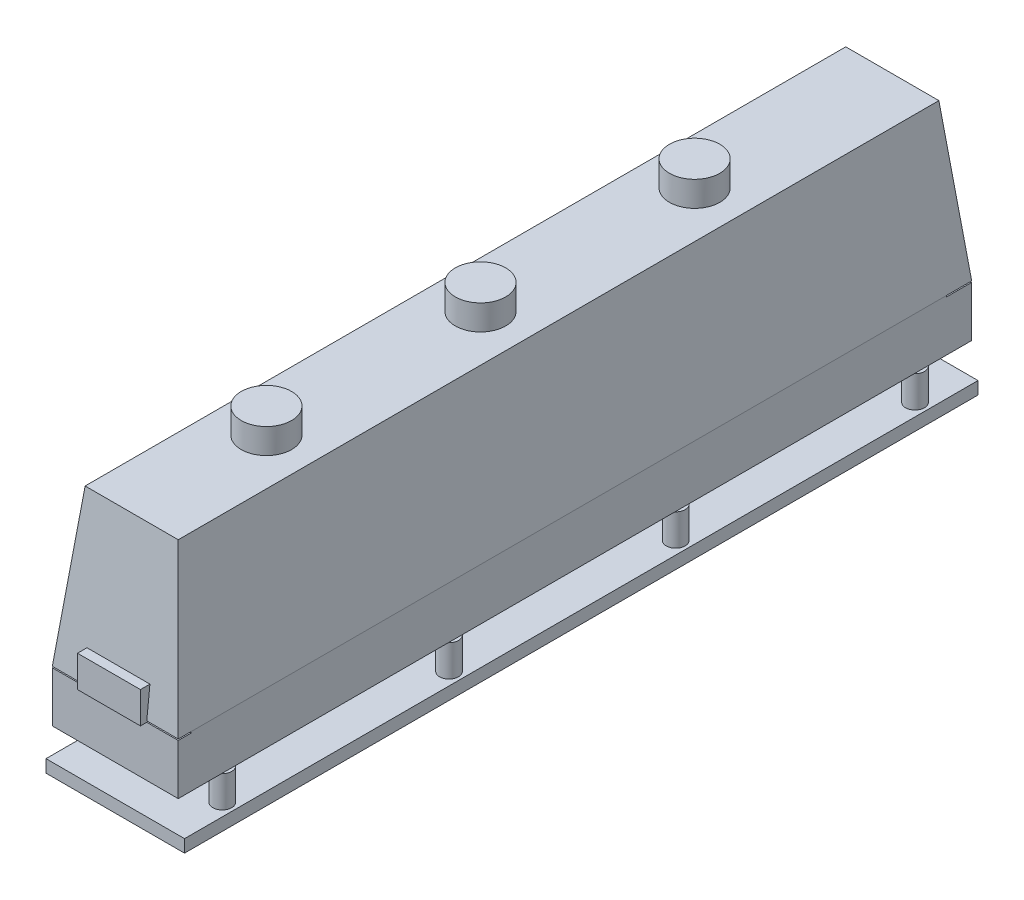
from build123d import *

# Parameters (mm, degrees)
SKETCH1_W            = 1100
SKETCH1_H            = 6300
BOSS_EXTRUDE1_DEPTH  = 100
BOSS_EXTRUDE2_START  = 100
SKETCH2_R            = 75
BOSS_EXTRUDE2_DEPTH  = 250
BOSS_EXTRUDE3_START  = 100
SKETCH3_R            = 75
BOSS_EXTRUDE3_DEPTH  = 250
BOSS_EXTRUDE4_START  = 100
SKETCH4_R            = 75
BOSS_EXTRUDE4_DEPTH  = 250
BOSS_EXTRUDE5_START  = 100
SKETCH5_R            = 75
BOSS_EXTRUDE5_DEPTH  = 250
BOSS_EXTRUDE6_START  = 100
SKETCH6_R            = 75
BOSS_EXTRUDE6_DEPTH  = 250
BOSS_EXTRUDE7_START  = 100
SKETCH7_R            = 75
BOSS_EXTRUDE7_DEPTH  = 250
BOSS_EXTRUDE8_START  = 100
SKETCH8_R            = 75
BOSS_EXTRUDE8_DEPTH  = 250
BOSS_EXTRUDE9_START  = 100
SKETCH9_R            = 75
BOSS_EXTRUDE9_DEPTH  = 250
BOSS_EXTRUDE10_START = 350
SKETCH10_W           = 1000
SKETCH10_H           = 6300
BOSS_EXTRUDE10_DEPTH = 400
BOSS_EXTRUDE11_START = 750
SKETCH11_W           = 500
SKETCH11_H           = 300
BOSS_EXTRUDE11_DEPTH = 250
BOSS_EXTRUDE12_START = 750
SKETCH12_W           = 1000
SKETCH12_H           = 6000
BOSS_EXTRUDE12_DEPTH = 10
BOSS_EXTRUDE13_START = 760
SKETCH13_W           = 1000
SKETCH13_H           = 6300
BOSS_EXTRUDE13_DEPTH = 1240
BOSS_EXTRUDE13_TAPER = 6
BOSS_EXTRUDE14_START = 2000
SKETCH14_R           = 200
BOSS_EXTRUDE14_DEPTH = 200
BOSS_EXTRUDE15_START = 2000
SKETCH15_R           = 200
BOSS_EXTRUDE15_DEPTH = 200
BOSS_EXTRUDE16_START = 2000
SKETCH16_R           = 200
BOSS_EXTRUDE16_DEPTH = 200
BOSS_EXTRUDE17_START = 600
SKETCH17_W           = 500
SKETCH17_H           = 250
BOSS_EXTRUDE17_DEPTH = 150


with BuildPart() as part:
    # Sketch1 → Boss-Extrude1 (new body)
    with BuildSketch(Plane(origin=(0, 0, 0), x_dir=(1, 0, 0), z_dir=(0, 1, 0))):
        with Locations((0, 5750)):
            Rectangle(SKETCH1_W, SKETCH1_H)
    extrude(amount=BOSS_EXTRUDE1_DEPTH)

    # Sketch2 → Boss-Extrude2 (add)
    with BuildSketch(Plane(origin=(0, 0, 0), x_dir=(1, 0, 0), z_dir=(0, 1, 0)).offset(BOSS_EXTRUDE2_START)):
        with Locations((-450, 3000)):
            Circle(SKETCH2_R)
    extrude(amount=BOSS_EXTRUDE2_DEPTH)

    # Sketch3 → Boss-Extrude3 (add)
    with BuildSketch(Plane(origin=(0, 0, 0), x_dir=(1, 0, 0), z_dir=(0, 1, 0)).offset(BOSS_EXTRUDE3_START)):
        with Locations((-450, 4800)):
            Circle(SKETCH3_R)
    extrude(amount=BOSS_EXTRUDE3_DEPTH)

    # Sketch4 → Boss-Extrude4 (add)
    with BuildSketch(Plane(origin=(0, 0, 0), x_dir=(1, 0, 0), z_dir=(0, 1, 0)).offset(BOSS_EXTRUDE4_START)):
        with Locations((-450, 6600)):
            Circle(SKETCH4_R)
    extrude(amount=BOSS_EXTRUDE4_DEPTH)

    # Sketch5 → Boss-Extrude5 (add)
    with BuildSketch(Plane(origin=(0, 0, 0), x_dir=(1, 0, 0), z_dir=(0, 1, 0)).offset(BOSS_EXTRUDE5_START)):
        with Locations((-450, 8500)):
            Circle(SKETCH5_R)
    extrude(amount=BOSS_EXTRUDE5_DEPTH)

    # Sketch6 → Boss-Extrude6 (add)
    with BuildSketch(Plane(origin=(0, 0, 0), x_dir=(1, 0, 0), z_dir=(0, 1, 0)).offset(BOSS_EXTRUDE6_START)):
        with Locations((450, 3000)):
            Circle(SKETCH6_R)
    extrude(amount=BOSS_EXTRUDE6_DEPTH)

    # Sketch7 → Boss-Extrude7 (add)
    with BuildSketch(Plane(origin=(0, 0, 0), x_dir=(1, 0, 0), z_dir=(0, 1, 0)).offset(BOSS_EXTRUDE7_START)):
        with Locations((450, 4800)):
            Circle(SKETCH7_R)
    extrude(amount=BOSS_EXTRUDE7_DEPTH)

    # Sketch8 → Boss-Extrude8 (add)
    with BuildSketch(Plane(origin=(0, 0, 0), x_dir=(1, 0, 0), z_dir=(0, 1, 0)).offset(BOSS_EXTRUDE8_START)):
        with Locations((450, 6600)):
            Circle(SKETCH8_R)
    extrude(amount=BOSS_EXTRUDE8_DEPTH)

    # Sketch9 → Boss-Extrude9 (add)
    with BuildSketch(Plane(origin=(0, 0, 0), x_dir=(1, 0, 0), z_dir=(0, 1, 0)).offset(BOSS_EXTRUDE9_START)):
        with Locations((450, 8500)):
            Circle(SKETCH9_R)
    extrude(amount=BOSS_EXTRUDE9_DEPTH)

    # Sketch10 → Boss-Extrude10 (add)
    with BuildSketch(Plane(origin=(0, 0, 0), x_dir=(1, 0, 0), z_dir=(0, 1, 0)).offset(BOSS_EXTRUDE10_START)):
        with Locations((0, 5750)):
            Rectangle(SKETCH10_W, SKETCH10_H)
    extrude(amount=BOSS_EXTRUDE10_DEPTH)

    # Sketch11 → Boss-Extrude11 (add)
    with BuildSketch(Plane(origin=(0, 0, 0), x_dir=(1, 0, 0), z_dir=(0, 1, 0)).offset(BOSS_EXTRUDE11_START)):
        with Locations((0, 2700)):
            Rectangle(SKETCH11_W, SKETCH11_H)
    extrude(amount=BOSS_EXTRUDE11_DEPTH)

    # Sketch12 → Boss-Extrude12 (add)
    with BuildSketch(Plane(origin=(0, 0, 0), x_dir=(1, 0, 0), z_dir=(0, 1, 0)).offset(BOSS_EXTRUDE12_START)):
        with Locations((0, 5700)):
            Rectangle(SKETCH12_W, SKETCH12_H)
    extrude(amount=BOSS_EXTRUDE12_DEPTH)

    # Sketch13 → Boss-Extrude13 (add)
    with BuildSketch(Plane(origin=(0, 0, 0), x_dir=(1, 0, 0), z_dir=(0, 1, 0)).offset(BOSS_EXTRUDE13_START)):
        with Locations((0, 5750)):
            Rectangle(SKETCH13_W, SKETCH13_H)
    extrude(amount=BOSS_EXTRUDE13_DEPTH, taper=BOSS_EXTRUDE13_TAPER)

    # Sketch14 → Boss-Extrude14 (add)
    with BuildSketch(Plane(origin=(0, 0, 0), x_dir=(1, 0, 0), z_dir=(0, 1, 0)).offset(BOSS_EXTRUDE14_START)):
        with Locations((0, 3800)):
            Circle(SKETCH14_R)
    extrude(amount=BOSS_EXTRUDE14_DEPTH)

    # Sketch15 → Boss-Extrude15 (add)
    with BuildSketch(Plane(origin=(0, 0, 0), x_dir=(1, 0, 0), z_dir=(0, 1, 0)).offset(BOSS_EXTRUDE15_START)):
        with Locations((0, 5500)):
            Circle(SKETCH15_R)
    extrude(amount=BOSS_EXTRUDE15_DEPTH)

    # Sketch16 → Boss-Extrude16 (add)
    with BuildSketch(Plane(origin=(0, 0, 0), x_dir=(1, 0, 0), z_dir=(0, 1, 0)).offset(BOSS_EXTRUDE16_START)):
        with Locations((0, 7200)):
            Circle(SKETCH16_R)
    extrude(amount=BOSS_EXTRUDE16_DEPTH)

    # Sketch17 → Boss-Extrude17 (add)
    with BuildSketch(Plane(origin=(0, 0, 0), x_dir=(1, 0, 0), z_dir=(0, 1, 0)).offset(BOSS_EXTRUDE17_START)):
        with Locations((0, 8825)):
            Rectangle(SKETCH17_W, SKETCH17_H)
    extrude(amount=BOSS_EXTRUDE17_DEPTH)


solid = part.part
